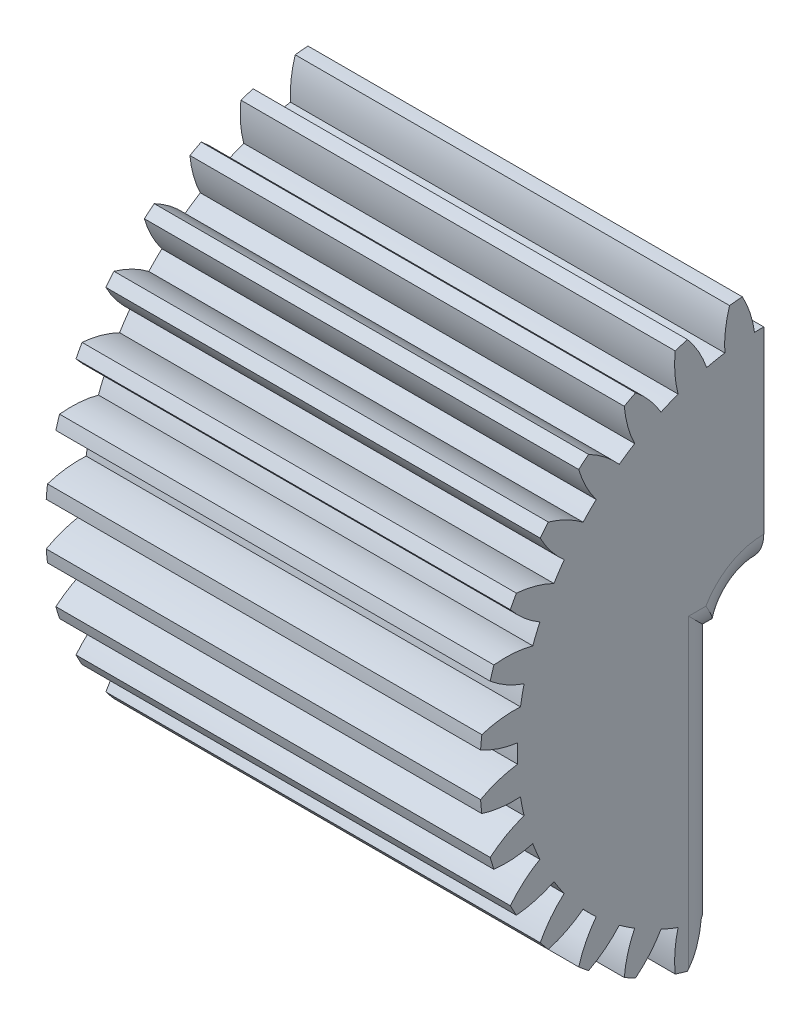
from build123d import *

# Parameters (mm, degrees)
BASPROSKE_W              = 10
BASPROSKE_H              = 8.5
TOOTHCUT_DEPTH           = 16.636495771
TEETHCUTS_COUNT          = 32
TEETHCUTS_ANGLE          = 348.75
BORSKE_R                 = 1
BORE_DEPTH               = 50.0000508
SKETCH1_W                = 2.2
SKETCH1_H                = 12
CUT_EXTRUDE1_DEPTH       = 16.610070769
BOSS_EXTRUDE1_DEPTH      = 0.5
BOSS_EXTRUDE1_DEPTH_BACK = 0.5
SKETCH4_R                = 1.125
SKETCH4_R_2              = 0.5
BOSS_EXTRUDE2_REACH      = 18.234
SKETCH5_W                = 2.5
SKETCH5_H                = 8.148803967
SKETCH6_R                = 2.25
CUT_EXTRUDE4_DEPTH       = 2.45
SKETCH7_R                = 0.5
CUT_EXTRUDE5_DEPTH       = 2.4
SKETCH8_W                = 11
SKETCH8_H                = 18
CUT_EXTRUDE6_DEPTH       = 10
SKETCH9_W                = 2
SKETCH9_H                = 2
BOSS_EXTRUDE3_DEPTH      = 2
SKETCH10_W               = 1.25
SKETCH10_H               = 9
CUT_EXTRUDE7_DEPTH       = 7
BOSS_EXTRUDE4_REACH      = 18.961
SKETCH12_R               = 1.125
SKETCH12_R_2             = 0.5
BOSS_EXTRUDE5_DEPTH      = 1
SKETCH13_W               = 1.7
SKETCH13_H               = 4
CUT_EXTRUDE8_DEPTH       = 17.960964283
BOSS_EXTRUDE6_DEPTH      = 1.25
FILLET1_R                = 1


with BuildPart() as part:
    # BasProSke → Base-Revolve (revolve)
    with BuildSketch(Plane(origin=(0, 0, 0), x_dir=(1, 0, 0), z_dir=(0, 1, 0)), mode=Mode.PRIVATE) as base_revolve_sk:
        with Locations((5, 4.25)):
            Rectangle(BASPROSKE_W, BASPROSKE_H)
    revolve(base_revolve_sk.sketch.rotate(Axis((-10, 0, 0), (1, 0, 0)), 180), axis=Axis((-10, 0, 0), (1, 0, 0)))

    # TooCutSke → ToothCut (cut, through all)
    with BuildSketch(Plane(origin=(0, 0, 0), x_dir=(0, 0, -1), z_dir=(1, 0, 0))):
        with BuildLine():
            ThreePointArc((0.277002447, 7.3687954), (0, 7.374), (-0.277002447, 7.3687954))
            ThreePointArc((-0.277002447, 7.3687954), (-0.41335061, 7.952280695), (-0.656086882, 8.500117362))
            ThreePointArc((-0.656086882, 8.500117362), (0, 8.5254), (0.656086882, 8.500117362))
            ThreePointArc((0.656086882, 8.500117362), (0.41335061, 7.952280695), (0.277002447, 7.3687954))
        make_face()
    toothcut = extrude(amount=TOOTHCUT_DEPTH, mode=Mode.SUBTRACT)

    # TeethCuts: ToothCut ×32 about axis
    teethcuts_axis = Axis((-10, 0, 0), (1, 0, 0))
    for i in range(1, TEETHCUTS_COUNT):
        add(toothcut.rotate(teethcuts_axis, i * TEETHCUTS_ANGLE / (TEETHCUTS_COUNT - 1)), mode=Mode.SUBTRACT)

    # BorSke → Bore (cut, symmetric)
    with BuildSketch(Plane(origin=(0, 0, 0), x_dir=(0, 0, -1), z_dir=(1, 0, 0))):
        with Locations(Location((0, 0, 0), (0, 0, 180))):
            Circle(BORSKE_R)
    extrude(amount=BORE_DEPTH, both=True, mode=Mode.SUBTRACT)

    # Sketch1 → Cut-Extrude1 (cut, through all)
    with BuildSketch(Plane(origin=(10, 0, 0), x_dir=(0, 0, -1), z_dir=(1, 0, 0))):
        with Locations((0, -6)):
            Rectangle(SKETCH1_W, SKETCH1_H)
    extrude(amount=-CUT_EXTRUDE1_DEPTH, mode=Mode.SUBTRACT)

    # Sketch2 → Cut-Revolve1 (revolve, cut)
    with BuildSketch(Plane.XY):
        with BuildLine():
            Line((4.25, 0), (9.75, 0))
            ThreePointArc((9.75, 0), (7, 2.75), (4.25, 0))
        make_face()
    revolve(axis=Axis((4.25, 0, 0), (1, 0, 0)), mode=Mode.SUBTRACT)

    # Sketch4 → Boss-Extrude1 (add, two sides: drawn at the far end of the back side and taken through both)
    with BuildSketch(Plane.ZY.offset(-3).offset(-BOSS_EXTRUDE1_DEPTH_BACK)):
        Circle(SKETCH4_R)
        Circle(SKETCH4_R_2, mode=Mode.SUBTRACT)
    extrude(amount=BOSS_EXTRUDE1_DEPTH + BOSS_EXTRUDE1_DEPTH_BACK)

    # Sketch5 → Boss-Extrude2 (add, up to next)
    with BuildSketch(Plane.XY.offset(-1.1), mode=Mode.PRIVATE) as boss_extrude2_sk1:
        with Locations((1.25, -4.074401984)):
            Rectangle(SKETCH5_W, SKETCH5_H)
    boss_extrude2_tool1 = extrude(boss_extrude2_sk1.sketch, amount=BOSS_EXTRUDE2_REACH, mode=Mode.PRIVATE) - part.part
    add(boss_extrude2_tool1.solids().sort_by_distance((1.25, -4.074402, -1.1))[0])

    # Sketch6 → Cut-Extrude4 (cut)
    with BuildSketch(Plane.ZY):
        Circle(SKETCH6_R)
    extrude(amount=-CUT_EXTRUDE4_DEPTH, mode=Mode.SUBTRACT)

    # Sketch7 → Cut-Extrude5 (cut)
    with BuildSketch(Plane(origin=(2.5, 0, 0), x_dir=(0, 0, -1), z_dir=(1, 0, 0))):
        with Locations(Location((0, 0, 0), (0, 0, 180))):
            Circle(SKETCH7_R)
    extrude(amount=-CUT_EXTRUDE5_DEPTH, mode=Mode.SUBTRACT)

    # Sketch8 → Cut-Extrude6 (cut)
    with BuildSketch(Plane.XY):
        with Locations((5, 0)):
            Rectangle(SKETCH8_W, SKETCH8_H)
    extrude(amount=-CUT_EXTRUDE6_DEPTH, mode=Mode.SUBTRACT)

    # Sketch9 → Boss-Extrude3 (add)
    with BuildSketch(Plane(origin=(0, 0, 0), x_dir=(-1, 0, 0), z_dir=(0, 0, -1))):
        with Locations((-7.5, 4.75)):
            Rectangle(SKETCH9_W, SKETCH9_H)
        with Locations((-2.5, 4.75)):
            Rectangle(SKETCH9_W, SKETCH9_H)
    extrude(amount=BOSS_EXTRUDE3_DEPTH)

    # Sketch10 → Cut-Extrude7 (cut)
    with BuildSketch(Plane(origin=(10, 0, 0), x_dir=(0, 0, -1), z_dir=(1, 0, 0))):
        with Locations((-0.625, -4.5)):
            Rectangle(SKETCH10_W, SKETCH10_H)
    extrude(amount=-CUT_EXTRUDE7_DEPTH, mode=Mode.SUBTRACT)

    # Sketch11 → Boss-Extrude4 (add, up to next)
    with BuildSketch(Plane(origin=(12, 0, 0), x_dir=(0, 0, -1), z_dir=(1, 0, 0)), mode=Mode.PRIVATE) as boss_extrude4_sk1:
        with BuildLine():
            Line((-1.25, 0), (-1.25, -7.267281197))
            ThreePointArc((-1.25, -7.267281197), (-1.480378414, -7.223874013), (-1.70926059, -7.173165566))
            ThreePointArc((-1.70926059, -7.173165566), (-1.949908855, -7.706695879), (-2.283707519, -8.187470914))
            ThreePointArc((-2.283707519, -8.187470914), (-2.467419757, -8.133992854), (-2.649881718, -8.076393185))
            ThreePointArc((-2.649881718, -8.076393185), (-2.660320865, -7.491194752), (-2.563999025, -6.913883496))
            ThreePointArc((-2.563999025, -6.913883496), (-2.82190763, -6.812687673), (-3.075832807, -6.701875002))
            ThreePointArc((-3.075832807, -6.701875002), (-3.415943684, -7.178205532), (-3.837123056, -7.584621721))
            ThreePointArc((-3.837123056, -7.584621721), (-4.006872263, -7.496330747), (-4.174591131, -7.404241277))
            ThreePointArc((-4.174591131, -7.404241277), (-4.070663142, -6.828250691), (-3.86356426, -6.280823768))
            ThreePointArc((-3.86356426, -6.280823768), (-4.096774898, -6.131256921), (-4.324202495, -5.97303514))
            ThreePointArc((-4.324202495, -5.97303514), (-4.750705713, -6.373860772), (-5.243080107, -6.690299769))
            ThreePointArc((-5.243080107, -6.690299769), (-5.392342915, -6.570588854), (-5.538873348, -6.447548529))
            ThreePointArc((-5.538873348, -6.447548529), (-5.324572118, -5.902900785), (-5.014654888, -5.406395505))
            ThreePointArc((-5.014654888, -5.406395505), (-5.214205404, -5.214205404), (-5.406395505, -5.014654888))
            ThreePointArc((-5.406395505, -5.014654888), (-5.902900785, -5.324572118), (-6.447548529, -5.538873348))
            ThreePointArc((-6.447548529, -5.538873348), (-6.570588854, -5.392342915), (-6.690299769, -5.243080107))
            ThreePointArc((-6.690299769, -5.243080107), (-6.373860772, -4.750705713), (-5.97303514, -4.324202495))
            ThreePointArc((-5.97303514, -4.324202495), (-6.131256921, -4.096774898), (-6.280823768, -3.86356426))
            ThreePointArc((-6.280823768, -3.86356426), (-6.828250691, -4.070663142), (-7.404241277, -4.174591131))
            ThreePointArc((-7.404241277, -4.174591131), (-7.496330747, -4.006872263), (-7.584621721, -3.837123056))
            ThreePointArc((-7.584621721, -3.837123056), (-7.178205532, -3.415943684), (-6.701875002, -3.075832807))
            ThreePointArc((-6.701875002, -3.075832807), (-6.812687673, -2.82190763), (-6.913883496, -2.563999025))
            ThreePointArc((-6.913883496, -2.563999025), (-7.491194752, -2.660320865), (-8.076393185, -2.649881718))
            ThreePointArc((-8.076393185, -2.649881718), (-8.133992854, -2.467419757), (-8.187470914, -2.283707519))
            ThreePointArc((-8.187470914, -2.283707519), (-7.706695879, -1.949908855), (-7.173165566, -1.70926059))
            ThreePointArc((-7.173165566, -1.70926059), (-7.232310658, -1.438596035), (-7.281246559, -1.165900745))
            ThreePointArc((-7.281246559, -1.165900745), (-7.866256399, -1.14774395), (-8.438173832, -1.023338837))
            ThreePointArc((-8.438173832, -1.023338837), (-8.459070177, -0.833145693), (-8.475680191, -0.642530382))
            ThreePointArc((-8.475680191, -0.642530382), (-7.939022225, -0.408940123), (-7.3687954, -0.277002447))
            ThreePointArc((-7.3687954, -0.277002447), (-7.374, 0), (-7.3687954, 0.277002447))
            ThreePointArc((-7.3687954, 0.277002447), (-7.939022225, 0.408940123), (-8.475680191, 0.642530382))
            ThreePointArc((-8.475680191, 0.642530382), (-8.459070177, 0.833145693), (-8.438173832, 1.023338837))
            ThreePointArc((-8.438173832, 1.023338837), (-7.866256399, 1.14774395), (-7.281246559, 1.165900745))
            ThreePointArc((-7.281246559, 1.165900745), (-7.232310658, 1.438596035), (-7.173165566, 1.70926059))
            ThreePointArc((-7.173165566, 1.70926059), (-7.706695879, 1.949908855), (-8.187470914, 2.283707519))
            ThreePointArc((-8.187470914, 2.283707519), (-8.133992854, 2.467419757), (-8.076393185, 2.649881718))
            ThreePointArc((-8.076393185, 2.649881718), (-7.491194752, 2.660320865), (-6.913883496, 2.563999025))
            ThreePointArc((-6.913883496, 2.563999025), (-6.812687673, 2.82190763), (-6.701875002, 3.075832807))
            ThreePointArc((-6.701875002, 3.075832807), (-7.178205532, 3.415943684), (-7.584621721, 3.837123056))
            ThreePointArc((-7.584621721, 3.837123056), (-7.496330747, 4.006872263), (-7.404241277, 4.174591131))
            ThreePointArc((-7.404241277, 4.174591131), (-6.828250691, 4.070663142), (-6.280823768, 3.86356426))
            ThreePointArc((-6.280823768, 3.86356426), (-6.131256921, 4.096774898), (-5.97303514, 4.324202495))
            ThreePointArc((-5.97303514, 4.324202495), (-6.373860772, 4.750705713), (-6.690299769, 5.243080107))
            ThreePointArc((-6.690299769, 5.243080107), (-6.570588854, 5.392342915), (-6.447548529, 5.538873348))
            ThreePointArc((-6.447548529, 5.538873348), (-5.902900785, 5.324572118), (-5.406395505, 5.014654888))
            ThreePointArc((-5.406395505, 5.014654888), (-5.214205404, 5.214205404), (-5.014654888, 5.406395505))
            ThreePointArc((-5.014654888, 5.406395505), (-5.324572118, 5.902900785), (-5.538873348, 6.447548529))
            ThreePointArc((-5.538873348, 6.447548529), (-5.392342915, 6.570588854), (-5.243080107, 6.690299769))
            ThreePointArc((-5.243080107, 6.690299769), (-4.750705713, 6.373860772), (-4.324202495, 5.97303514))
            ThreePointArc((-4.324202495, 5.97303514), (-4.096774898, 6.131256921), (-3.86356426, 6.280823768))
            ThreePointArc((-3.86356426, 6.280823768), (-4.070663142, 6.828250691), (-4.174591131, 7.404241277))
            ThreePointArc((-4.174591131, 7.404241277), (-4.006872263, 7.496330747), (-3.837123056, 7.584621721))
            ThreePointArc((-3.837123056, 7.584621721), (-3.415943684, 7.178205532), (-3.075832807, 6.701875002))
            ThreePointArc((-3.075832807, 6.701875002), (-2.82190763, 6.812687673), (-2.563999025, 6.913883496))
            ThreePointArc((-2.563999025, 6.913883496), (-2.660320865, 7.491194752), (-2.649881718, 8.076393185))
            ThreePointArc((-2.649881718, 8.076393185), (-2.467419757, 8.133992854), (-2.283707519, 8.187470914))
            ThreePointArc((-2.283707519, 8.187470914), (-1.949908855, 7.706695879), (-1.70926059, 7.173165566))
            ThreePointArc((-1.70926059, 7.173165566), (-1.438596035, 7.232310658), (-1.165900745, 7.281246559))
            ThreePointArc((-1.165900745, 7.281246559), (-1.14774395, 7.866256399), (-1.023338837, 8.438173832))
            ThreePointArc((-1.023338837, 8.438173832), (-0.833145693, 8.459070177), (-0.642530382, 8.475680191))
            ThreePointArc((-0.642530382, 8.475680191), (-0.408940123, 7.939022225), (-0.277002447, 7.3687954))
            ThreePointArc((-0.277002447, 7.3687954), (-0.138525669, 7.372698735), (0, 7.374))
            Line((0, 7.374), (0, 1))
            ThreePointArc((0, 1), (-0.707106781, 0.707106781), (-1, 0))
            Line((-1, 0), (-1.25, 0))
        make_face()
    boss_extrude4_tool1 = extrude(boss_extrude4_sk1.sketch, amount=-BOSS_EXTRUDE4_REACH, mode=Mode.PRIVATE) - part.part
    add(boss_extrude4_tool1.solids().sort_by_distance((12, 0.4527, 3.714882))[0])

    # Sketch12 → Boss-Extrude5 (add)
    with BuildSketch(Plane.ZY.offset(-2.45)):
        Circle(SKETCH12_R)
        Circle(SKETCH12_R_2, mode=Mode.SUBTRACT)
    extrude(amount=-BOSS_EXTRUDE5_DEPTH)

    # Sketch13 → Cut-Extrude8 (cut, through all)
    with BuildSketch(Plane(origin=(0, 0, 0), x_dir=(-1, 0, 0), z_dir=(0, 0, -1))):
        with Locations((-2.808045716, 0.106885372)):
            Rectangle(SKETCH13_W, SKETCH13_H)
    extrude(amount=CUT_EXTRUDE8_DEPTH, mode=Mode.SUBTRACT)

    # Sketch14 → Boss-Extrude6 (add)
    with BuildSketch(Plane(origin=(13, 0, 0), x_dir=(0, 0, -1), z_dir=(1, 0, 0))):
        with BuildLine():
            Line((-1.25, 0), (-1.25, -7.267281197))
            ThreePointArc((-1.25, -7.267281197), (-1.480378414, -7.223874013), (-1.70926059, -7.173165566))
            ThreePointArc((-1.70926059, -7.173165566), (-1.949908855, -7.706695879), (-2.283707519, -8.187470914))
            ThreePointArc((-2.283707519, -8.187470914), (-2.467419757, -8.133992854), (-2.649881718, -8.076393185))
            ThreePointArc((-2.649881718, -8.076393185), (-2.660320865, -7.491194752), (-2.563999025, -6.913883496))
            ThreePointArc((-2.563999025, -6.913883496), (-2.82190763, -6.812687673), (-3.075832807, -6.701875002))
            ThreePointArc((-3.075832807, -6.701875002), (-3.415943684, -7.178205532), (-3.837123056, -7.584621721))
            ThreePointArc((-3.837123056, -7.584621721), (-4.006872263, -7.496330747), (-4.174591131, -7.404241277))
            ThreePointArc((-4.174591131, -7.404241277), (-4.070663142, -6.828250691), (-3.86356426, -6.280823768))
            ThreePointArc((-3.86356426, -6.280823768), (-4.096774898, -6.131256921), (-4.324202495, -5.97303514))
            ThreePointArc((-4.324202495, -5.97303514), (-4.750705713, -6.373860772), (-5.243080107, -6.690299769))
            ThreePointArc((-5.243080107, -6.690299769), (-5.392342915, -6.570588854), (-5.538873348, -6.447548529))
            ThreePointArc((-5.538873348, -6.447548529), (-5.324572118, -5.902900785), (-5.014654888, -5.406395505))
            ThreePointArc((-5.014654888, -5.406395505), (-5.214205404, -5.214205404), (-5.406395505, -5.014654888))
            ThreePointArc((-5.406395505, -5.014654888), (-5.902900785, -5.324572118), (-6.447548529, -5.538873348))
            ThreePointArc((-6.447548529, -5.538873348), (-6.570588854, -5.392342915), (-6.690299769, -5.243080107))
            ThreePointArc((-6.690299769, -5.243080107), (-6.373860772, -4.750705713), (-5.97303514, -4.324202495))
            ThreePointArc((-5.97303514, -4.324202495), (-6.131256921, -4.096774898), (-6.280823768, -3.86356426))
            ThreePointArc((-6.280823768, -3.86356426), (-6.828250691, -4.070663142), (-7.404241277, -4.174591131))
            ThreePointArc((-7.404241277, -4.174591131), (-7.496330747, -4.006872263), (-7.584621721, -3.837123056))
            ThreePointArc((-7.584621721, -3.837123056), (-7.178205532, -3.415943684), (-6.701875002, -3.075832807))
            ThreePointArc((-6.701875002, -3.075832807), (-6.812687673, -2.82190763), (-6.913883496, -2.563999025))
            ThreePointArc((-6.913883496, -2.563999025), (-7.491194752, -2.660320865), (-8.076393185, -2.649881718))
            ThreePointArc((-8.076393185, -2.649881718), (-8.133992854, -2.467419757), (-8.187470914, -2.283707519))
            ThreePointArc((-8.187470914, -2.283707519), (-7.706695879, -1.949908855), (-7.173165566, -1.70926059))
            ThreePointArc((-7.173165566, -1.70926059), (-7.232310658, -1.438596035), (-7.281246559, -1.165900745))
            ThreePointArc((-7.281246559, -1.165900745), (-7.866256399, -1.14774395), (-8.438173832, -1.023338837))
            ThreePointArc((-8.438173832, -1.023338837), (-8.459070177, -0.833145693), (-8.475680191, -0.642530382))
            ThreePointArc((-8.475680191, -0.642530382), (-7.939022225, -0.408940123), (-7.3687954, -0.277002447))
            ThreePointArc((-7.3687954, -0.277002447), (-7.374, 0), (-7.3687954, 0.277002447))
            ThreePointArc((-7.3687954, 0.277002447), (-7.939022225, 0.408940123), (-8.475680191, 0.642530382))
            ThreePointArc((-8.475680191, 0.642530382), (-8.459070177, 0.833145693), (-8.438173832, 1.023338837))
            ThreePointArc((-8.438173832, 1.023338837), (-7.866256399, 1.14774395), (-7.281246559, 1.165900745))
            ThreePointArc((-7.281246559, 1.165900745), (-7.232310658, 1.438596035), (-7.173165566, 1.70926059))
            ThreePointArc((-7.173165566, 1.70926059), (-7.706695879, 1.949908855), (-8.187470914, 2.283707519))
            ThreePointArc((-8.187470914, 2.283707519), (-8.133992854, 2.467419757), (-8.076393185, 2.649881718))
            ThreePointArc((-8.076393185, 2.649881718), (-7.491194752, 2.660320865), (-6.913883496, 2.563999025))
            ThreePointArc((-6.913883496, 2.563999025), (-6.812687673, 2.82190763), (-6.701875002, 3.075832807))
            ThreePointArc((-6.701875002, 3.075832807), (-7.178205532, 3.415943684), (-7.584621721, 3.837123056))
            ThreePointArc((-7.584621721, 3.837123056), (-7.496330747, 4.006872263), (-7.404241277, 4.174591131))
            ThreePointArc((-7.404241277, 4.174591131), (-6.828250691, 4.070663142), (-6.280823768, 3.86356426))
            ThreePointArc((-6.280823768, 3.86356426), (-6.131256921, 4.096774898), (-5.97303514, 4.324202495))
            ThreePointArc((-5.97303514, 4.324202495), (-6.373860772, 4.750705713), (-6.690299769, 5.243080107))
            ThreePointArc((-6.690299769, 5.243080107), (-6.570588854, 5.392342915), (-6.447548529, 5.538873348))
            ThreePointArc((-6.447548529, 5.538873348), (-5.902900785, 5.324572118), (-5.406395505, 5.014654888))
            ThreePointArc((-5.406395505, 5.014654888), (-5.214205404, 5.214205404), (-5.014654888, 5.406395505))
            ThreePointArc((-5.014654888, 5.406395505), (-5.324572118, 5.902900785), (-5.538873348, 6.447548529))
            ThreePointArc((-5.538873348, 6.447548529), (-5.392342915, 6.570588854), (-5.243080107, 6.690299769))
            ThreePointArc((-5.243080107, 6.690299769), (-4.750705713, 6.373860772), (-4.324202495, 5.97303514))
            ThreePointArc((-4.324202495, 5.97303514), (-4.096774898, 6.131256921), (-3.86356426, 6.280823768))
            ThreePointArc((-3.86356426, 6.280823768), (-4.070663142, 6.828250691), (-4.174591131, 7.404241277))
            ThreePointArc((-4.174591131, 7.404241277), (-4.006872263, 7.496330747), (-3.837123056, 7.584621721))
            ThreePointArc((-3.837123056, 7.584621721), (-3.415943684, 7.178205532), (-3.075832807, 6.701875002))
            ThreePointArc((-3.075832807, 6.701875002), (-2.82190763, 6.812687673), (-2.563999025, 6.913883496))
            ThreePointArc((-2.563999025, 6.913883496), (-2.660320865, 7.491194752), (-2.649881718, 8.076393185))
            ThreePointArc((-2.649881718, 8.076393185), (-2.467419757, 8.133992854), (-2.283707519, 8.187470914))
            ThreePointArc((-2.283707519, 8.187470914), (-1.949908855, 7.706695879), (-1.70926059, 7.173165566))
            ThreePointArc((-1.70926059, 7.173165566), (-1.438596035, 7.232310658), (-1.165900745, 7.281246559))
            ThreePointArc((-1.165900745, 7.281246559), (-1.14774395, 7.866256399), (-1.023338837, 8.438173832))
            ThreePointArc((-1.023338837, 8.438173832), (-0.833145693, 8.459070177), (-0.642530382, 8.475680191))
            ThreePointArc((-0.642530382, 8.475680191), (-0.408940123, 7.939022225), (-0.277002447, 7.3687954))
            ThreePointArc((-0.277002447, 7.3687954), (-0.138525669, 7.372698735), (0, 7.374))
            Line((0, 7.374), (0, 1))
            ThreePointArc((0, 1), (-0.707106781, 0.707106781), (-1, 0))
            Line((-1, 0), (-1.25, 0))
        make_face()
    extrude(amount=-BOSS_EXTRUDE6_DEPTH)

    # Fillet1
    fillet1_edges = [part.edges().sort_by_distance(p)[0] for p in [
        (13, 0, 1.125),
        (13, 0.707106781, 0.707106781),
        (13, -3.633640599, 1.25),
    ]]
    fillet(fillet1_edges, radius=FILLET1_R - 0.0001)  # a hair under: the kernel refuses the full size


solid = part.part
